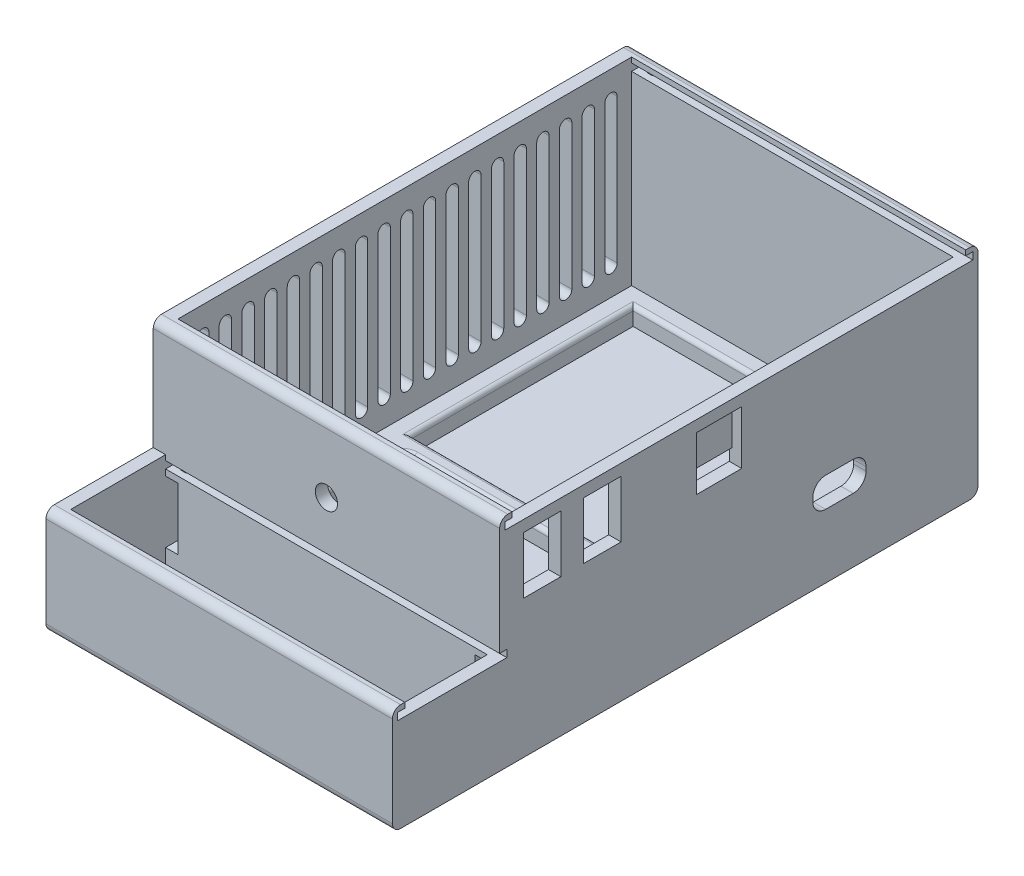
from build123d import *

# Parameters (mm, degrees)
SKETCH1_W            = 100
SKETCH1_H            = 150
BOSS_EXTRUDE1_DEPTH  = 5
SKETCH2_W            = 78
SKETCH2_H            = 23
CUT_EXTRUDE1_DEPTH   = 2.5
SKETCH3_W            = 84
SKETCH3_H            = 29
SKETCH3_W_2          = 78
SKETCH3_H_2          = 23
BOSS_EXTRUDE2_DEPTH  = 18
CUT_EXTRUDE2_DEPTH   = 4.25
CUT_EXTRUDE3_DEPTH   = 0.5
SKETCH8_W            = 3
SKETCH8_H            = 15
CUT_EXTRUDE4_DEPTH   = 3
SKETCH9_W            = 29
SKETCH9_H            = 3
BOSS_EXTRUDE4_DEPTH  = 3
BOSS_EXTRUDE5_DEPTH  = 81
CUT_EXTRUDE5_DEPTH   = 5
BOSS_EXTRUDE6_DEPTH  = 45
SKETCH14_W           = 68.5
SKETCH14_H           = 53.4
CUT_EXTRUDE6_DEPTH   = 4.25
SKETCH46_W           = 69
SKETCH46_H           = 53.9
SKETCH46_W_2         = 68.5
SKETCH46_H_2         = 53.4
CUT_EXTRUDE25_DEPTH  = 4.25
SKETCH15_W           = 84
SKETCH15_H           = 3
BOSS_EXTRUDE7_DEPTH  = 24
BOSS_EXTRUDE8_DEPTH  = 3
SKETCH19_W           = 1.75
SKETCH19_H           = 1.75
CUT_EXTRUDE8_DEPTH   = 81
SKETCH23_W           = 1.75
SKETCH23_H           = 1.25
BOSS_EXTRUDE9_DEPTH  = 0.4
FILLET2_R            = 0.4
SKETCH40_W           = 1.75
SKETCH40_H           = 1.25
BOSS_EXTRUDE14_DEPTH = 0.4
FILLET6_R            = 0.4
SKETCH25_W           = 1.75
SKETCH25_H           = 1.25
BOSS_EXTRUDE11_DEPTH = 0.4
FILLET4_R            = 0.4
SKETCH26_W           = 1.75
SKETCH26_H           = 1.25
BOSS_EXTRUDE12_DEPTH = 0.4
FILLET5_R            = 0.4
SKETCH27_W           = 10.45
SKETCH27_H           = 12.5
CUT_EXTRUDE10_DEPTH  = 3
SKETCH29_W           = 8.6
SKETCH29_H           = 13.3
CUT_EXTRUDE11_DEPTH  = 3
SKETCH30_R           = 2.5
CUT_EXTRUDE12_DEPTH  = 3
CUT_EXTRUDE13_DEPTH  = 3
CUT_EXTRUDE15_DEPTH  = 3
CUT_EXTRUDE16_DEPTH  = 4.25
SKETCH36_W           = 10.95
SKETCH36_H           = 13
SKETCH36_W_2         = 9.1
SKETCH36_H_2         = 13.8
CUT_EXTRUDE18_DEPTH  = 3
SKETCH37_R           = 2.7
CUT_EXTRUDE19_DEPTH  = 3
SKETCH38_W           = 10.95
SKETCH38_H           = 9.86
BOSS_EXTRUDE13_DEPTH = 0.6
CUT_EXTRUDE20_DEPTH  = 3
FILLET18_R           = 2
FILLET19_R           = 1


with BuildPart() as part:
    # Sketch1 → Boss-Extrude1 (new body)
    with BuildSketch(Plane(origin=(0, 0, 0), x_dir=(1, 0, 0), z_dir=(0, 1, 0))):
        with Locations((50, 75)):
            Rectangle(SKETCH1_W, SKETCH1_H)
    extrude(amount=-BOSS_EXTRUDE1_DEPTH)

    # Sketch2 → Cut-Extrude1 (cut)
    with BuildSketch(Plane(origin=(0, 0, 0), x_dir=(1, 0, 0), z_dir=(0, 1, 0))):
        with Locations((50, 22.5)):
            Rectangle(SKETCH2_W, SKETCH2_H)
    extrude(amount=-CUT_EXTRUDE1_DEPTH, mode=Mode.SUBTRACT)

    # Sketch3 → Boss-Extrude2 (add)
    with BuildSketch(Plane(origin=(0, 0, 0), x_dir=(1, 0, 0), z_dir=(0, 1, 0))):
        with Locations((50, 22.5)):
            Rectangle(SKETCH3_W, SKETCH3_H)
        with Locations((50, 22.5)):
            Rectangle(SKETCH3_W_2, SKETCH3_H_2, mode=Mode.SUBTRACT)
    extrude(amount=BOSS_EXTRUDE2_DEPTH)

    # Sketch4 → Cut-Extrude2 (cut)
    with BuildSketch(Plane(origin=(0, 0, 0), x_dir=(1, 0, 0), z_dir=(0, 1, 0))):
        with BuildLine():
            Line((17.27, 44), (79.94, 44))
            ThreePointArc((79.94, 44), (81.91282792, 44.81717208), (82.73, 46.79))
            Line((82.73, 46.79), (82.73, 82.03))
            ThreePointArc((82.73, 82.03), (81.91282792, 84.00282792), (79.94, 84.82))
            Line((79.94, 84.82), (20.06, 84.842465549))
            ThreePointArc((20.06, 84.842465549), (18.08717208, 84.025293468), (17.27, 82.052465549))
            Line((17.27, 82.052465549), (17.27, 44))
        make_face()
    extrude(amount=-CUT_EXTRUDE2_DEPTH, mode=Mode.SUBTRACT)

    # Sketch7 → Cut-Extrude3 (cut)
    with BuildSketch(Plane(origin=(0, -2.5, 0), x_dir=(1, 0, 0), z_dir=(0, 1, 0))):
        Polygon((11, 34), (34, 11), (32.978260085, 11), (11, 32.978260085), align=None)
        Polygon((12, 34), (35, 11), (36, 11), (13, 34), align=None)
        Polygon((11, 11), (11.521721863, 11), (11, 11.521721863), align=None)
        Polygon((89, 34), (89, 33), (88, 34), align=None)
        Polygon((14, 34), (37, 11), (38, 11), (15, 34), align=None)
        Polygon((16, 34), (39, 11), (40, 11), (17, 34), align=None)
        Polygon((18, 34), (41, 11), (42, 11), (19, 34), align=None)
        Polygon((20, 34), (43, 11), (44, 11), (21, 34), align=None)
        Polygon((22, 34), (45, 11), (46, 11), (23, 34), align=None)
        Polygon((24, 34), (47, 11), (48, 11), (25, 34), align=None)
        Polygon((26, 34), (49, 11), (50, 11), (27, 34), align=None)
        Polygon((28, 34), (51, 11), (52, 11), (29, 34), align=None)
        Polygon((30, 34), (53, 11), (54, 11), (31, 34), align=None)
        Polygon((32, 34), (55, 11), (56, 11), (33, 34), align=None)
        Polygon((34, 34), (57, 11), (58, 11), (35, 34), align=None)
        Polygon((36, 34), (59, 11), (60, 11), (37, 34), align=None)
        Polygon((38, 34), (61, 11), (62, 11), (39, 34), align=None)
        Polygon((40, 34), (63, 11), (64, 11), (41, 34), align=None)
        Polygon((42, 34), (65, 11), (66, 11), (43, 34), align=None)
        Polygon((44, 34), (67, 11), (68, 11), (45, 34), align=None)
        Polygon((46, 34), (69, 11), (70, 11), (47, 34), align=None)
        Polygon((48, 34), (71, 11), (72, 11), (49, 34), align=None)
        Polygon((50, 34), (73, 11), (74, 11), (51, 34), align=None)
        Polygon((52, 34), (75, 11), (76, 11), (53, 34), align=None)
        Polygon((54, 34), (77, 11), (78, 11), (55, 34), align=None)
        Polygon((56, 34), (79, 11), (80, 11), (57, 34), align=None)
        Polygon((58, 34), (81, 11), (82, 11), (59, 34), align=None)
        Polygon((60, 34), (83, 11), (84, 11), (61, 34), align=None)
        Polygon((62, 34), (85, 11), (86, 11), (63, 34), align=None)
        Polygon((64, 34), (87, 11), (88, 11), (65, 34), align=None)
        Polygon((66, 34), (89, 11), (89, 12), (67, 34), align=None)
        Polygon((68, 34), (89, 13), (89, 14), (69, 34), align=None)
        Polygon((70, 34), (89, 15), (89, 16), (71, 34), align=None)
        Polygon((72, 34), (89, 17), (89, 18), (73, 34), align=None)
        Polygon((74, 34), (89, 19), (89, 20), (75, 34), align=None)
        Polygon((76, 34), (89, 21), (89, 22), (77, 34), align=None)
        Polygon((78, 34), (89, 23), (89, 24), (79, 34), align=None)
        Polygon((80, 34), (89, 25), (89, 26), (81, 34), align=None)
        Polygon((82, 34), (89, 27), (89, 28), (83, 34), align=None)
        Polygon((84, 34), (89, 29), (89, 30), (85, 34), align=None)
        Polygon((86, 34), (89, 31), (89, 32), (87, 34), align=None)
        Polygon((11, 31.956520169), (31.956520169, 11), (30.934780254, 11), (11, 30.934780254), align=None)
        Polygon((11, 29.913040339), (29.913040339, 11), (28.891300423, 11), (11, 28.891300423), align=None)
        Polygon((11, 27.869560508), (27.869560508, 11), (26.847820593, 11), (11, 26.847820593), align=None)
        Polygon((11, 25.826080677), (25.826080677, 11), (24.804340762, 11), (11, 24.804340762), align=None)
        Polygon((11, 23.782600847), (23.782600847, 11), (22.760860931, 11), (11, 22.760860931), align=None)
        Polygon((11, 21.739121016), (21.739121016, 11), (20.717381101, 11), (11, 20.717381101), align=None)
        Polygon((11, 19.695641185), (19.695641185, 11), (18.67390127, 11), (11, 18.67390127), align=None)
        Polygon((11, 17.652161355), (17.652161355, 11), (16.630421439, 11), (11, 16.630421439), align=None)
        Polygon((11, 15.608681524), (15.608681524, 11), (14.586941609, 11), (11, 14.586941609), align=None)
        Polygon((11, 13.565201693), (13.565201693, 11), (12.543461778, 11), (11, 12.543461778), align=None)
    extrude(amount=-CUT_EXTRUDE3_DEPTH, mode=Mode.SUBTRACT)

    # Sketch8 → Cut-Extrude4 (cut)
    with BuildSketch(Plane(origin=(0, 0, -37), x_dir=(-1, 0, 0), z_dir=(0, 0, -1))):
        with Locations((-87.5, 9)):
            Rectangle(SKETCH8_W, SKETCH8_H)
        with Locations((-12.5, 9)):
            Rectangle(SKETCH8_W, SKETCH8_H)
    extrude(amount=-CUT_EXTRUDE4_DEPTH, mode=Mode.SUBTRACT)

    # Sketch9 → Boss-Extrude4 (add)
    with BuildSketch(Plane.ZY.offset(-8)):
        with Locations((-22.5, 19.5)):
            Rectangle(SKETCH9_W, SKETCH9_H)
    extrude(amount=-BOSS_EXTRUDE4_DEPTH)

    # Sketch10 → Boss-Extrude5 (add)
    with BuildSketch(Plane(origin=(11, 0, 0), x_dir=(0, 0, -1), z_dir=(1, 0, 0))):
        Polygon((9.25, 18), (8, 18), (8, 21), (11, 21), (11, 19.75), (9.25, 19.75), align=None)
        Polygon((35.75, 19.75), (35.75, 18), (37, 18), (37, 21), (34, 21), (34, 19.75), align=None)
    extrude(amount=BOSS_EXTRUDE5_DEPTH)

    # Sketch12 → Cut-Extrude5 (cut)
    with BuildSketch(Plane(origin=(0, 0, 0), x_dir=(1, 0, 0), z_dir=(0, 1, 0))):
        Polygon((0, 0), (100, 0), (100, 150), (92, 150), (92, 8), (8, 8), (8, 150), (0, 150), align=None)
    extrude(amount=-CUT_EXTRUDE5_DEPTH, mode=Mode.SUBTRACT)

    # Sketch13 → Boss-Extrude6 (add)
    with BuildSketch(Plane(origin=(0, 0, 0), x_dir=(1, 0, 0), z_dir=(0, 1, 0))):
        Polygon((8, 37), (8, 150), (92, 150), (92, 37), (89, 37), (89, 40), (89, 147), (11, 147), (11, 40), (11, 37), align=None)
    extrude(amount=BOSS_EXTRUDE6_DEPTH)

    # Sketch14 → Cut-Extrude6 (cut)
    with BuildSketch(Plane(origin=(0, 0, 0), x_dir=(1, 0, 0), z_dir=(0, 1, 0))):
        with Locations((50, 115.915616387)):
            Rectangle(SKETCH14_W, SKETCH14_H)
    extrude(amount=-CUT_EXTRUDE6_DEPTH, mode=Mode.SUBTRACT)

    # Sketch46 → Cut-Extrude25 (cut)
    with BuildSketch(Plane(origin=(0, 0, 0), x_dir=(1, 0, 0), z_dir=(0, 1, 0))):
        with Locations((50, 115.915616387)):
            Rectangle(SKETCH46_W, SKETCH46_H)
        with Locations((50, 115.915616387)):
            Rectangle(SKETCH46_W_2, SKETCH46_H_2, mode=Mode.SUBTRACT)
    extrude(amount=-CUT_EXTRUDE25_DEPTH, mode=Mode.SUBTRACT)

    # Sketch15 → Boss-Extrude7 (add)
    with BuildSketch(Plane(origin=(0, 21, 0), x_dir=(1, 0, 0), z_dir=(0, 1, 0))):
        with Locations((50, 35.5)):
            Rectangle(SKETCH15_W, SKETCH15_H)
    extrude(amount=BOSS_EXTRUDE7_DEPTH)

    # Sketch16 → Boss-Extrude8 (add)
    with BuildSketch(Plane(origin=(0, 45, 0), x_dir=(1, 0, 0), z_dir=(0, 1, 0))):
        Polygon((92, 34), (8, 34), (8, 150), (92, 150), (92, 147), (11, 147), (11, 37), (92, 37), align=None)
    extrude(amount=BOSS_EXTRUDE8_DEPTH)

    # Sketch19 → Cut-Extrude8 (cut)
    with BuildSketch(Plane(origin=(92, 0, 0), x_dir=(0, 0, -1), z_dir=(1, 0, 0))):
        with Locations((36.125, 45.875)):
            Rectangle(SKETCH19_W, SKETCH19_H)
        with Locations((147.875, 45.875)):
            Rectangle(SKETCH19_W, SKETCH19_H)
    extrude(amount=-CUT_EXTRUDE8_DEPTH, mode=Mode.SUBTRACT)

    # Sketch23 → Boss-Extrude9 (add)
    with BuildSketch(Plane(origin=(0, 0, -9.25), x_dir=(-1, 0, 0), z_dir=(0, 0, -1))):
        with Locations((-14, 18.875)):
            Rectangle(SKETCH23_W, SKETCH23_H)
    extrude(amount=BOSS_EXTRUDE9_DEPTH)

    # Fillet2
    fillet2_edges = [part.edges().sort_by_distance(p)[0] for p in [
        (13.125, 18.875, -9.65),
        (14.875, 18.875, -9.65),
    ]]
    fillet(fillet2_edges, radius=FILLET2_R - 0.0001)  # a hair under: the kernel refuses the full size

    # Sketch40 → Boss-Extrude14 (add)
    with BuildSketch(Plane.XY.offset(-35.75)):
        with Locations((14, 18.875)):
            Rectangle(SKETCH40_W, SKETCH40_H)
    extrude(amount=BOSS_EXTRUDE14_DEPTH)

    # Fillet6
    fillet6_edges = [part.edges().sort_by_distance(p)[0] for p in [
        (14.875, 18.875, -35.35),
        (13.125, 18.875, -35.35),
    ]]
    fillet(fillet6_edges, radius=FILLET6_R - 0.0001)  # a hair under: the kernel refuses the full size

    # Sketch25 → Boss-Extrude11 (add)
    with BuildSketch(Plane(origin=(0, 0, -35.25), x_dir=(-1, 0, 0), z_dir=(0, 0, -1))):
        with Locations((-14, 45.875)):
            Rectangle(SKETCH25_W, SKETCH25_H)
    extrude(amount=BOSS_EXTRUDE11_DEPTH)

    # Fillet4
    fillet4_edges = [part.edges().sort_by_distance(p)[0] for p in [
        (13.125, 45.875, -35.65),
        (14.875, 45.875, -35.65),
    ]]
    fillet(fillet4_edges, radius=FILLET4_R - 0.0001)  # a hair under: the kernel refuses the full size

    # Sketch26 → Boss-Extrude12 (add)
    with BuildSketch(Plane.XY.offset(-148.75)):
        with Locations((14, 45.875)):
            Rectangle(SKETCH26_W, SKETCH26_H)
    extrude(amount=BOSS_EXTRUDE12_DEPTH)

    # Fillet5
    fillet5_edges = [part.edges().sort_by_distance(p)[0] for p in [
        (13.125, 45.875, -148.35),
        (14.875, 45.875, -148.35),
    ]]
    fillet(fillet5_edges, radius=FILLET5_R - 0.0001)  # a hair under: the kernel refuses the full size

    # Sketch27 → Cut-Extrude10 (cut)
    with BuildSketch(Plane(origin=(92, 0, 0), x_dir=(0, 0, -1), z_dir=(1, 0, 0))):
        with Locations((87.225, 35.75)):
            Rectangle(SKETCH27_W, SKETCH27_H)
    extrude(amount=-CUT_EXTRUDE10_DEPTH, mode=Mode.SUBTRACT)

    # Sketch29 → Cut-Extrude11 (cut)
    with BuildSketch(Plane(origin=(92, 0, 0), x_dir=(0, 0, -1), z_dir=(1, 0, 0))):
        with Locations((44.3, 35.35)):
            Rectangle(SKETCH29_W, SKETCH29_H)
        with Locations((58.9, 35.35)):
            Rectangle(SKETCH29_W, SKETCH29_H)
    extrude(amount=-CUT_EXTRUDE11_DEPTH, mode=Mode.SUBTRACT)

    # Sketch30 → Cut-Extrude12 (cut)
    with BuildSketch(Plane.XY.offset(-34)):
        with Locations((50, 31.5)):
            Circle(SKETCH30_R)
    extrude(amount=-CUT_EXTRUDE12_DEPTH, mode=Mode.SUBTRACT)

    # Sketch31 → Cut-Extrude13 (cut)
    with BuildSketch(Plane(origin=(92, 0, 0), x_dir=(0, 0, -1), z_dir=(1, 0, 0))):
        with BuildLine():
            Line((113.05, 12.5), (119.75, 12.5))
            ThreePointArc((119.75, 12.5), (120.527817459, 12.822182541), (120.85, 13.6))
            Line((120.85, 13.6), (120.85, 14.55))
            ThreePointArc((120.85, 14.55), (120.527817459, 15.327817459), (119.75, 15.65))
            Line((119.75, 15.65), (113.05, 15.65))
            ThreePointArc((113.05, 15.65), (112.272182541, 15.327817459), (111.95, 14.55))
            Line((111.95, 14.55), (111.95, 13.6))
            ThreePointArc((111.95, 13.6), (112.272182541, 12.822182541), (113.05, 12.5))
        make_face()
    extrude(amount=-CUT_EXTRUDE13_DEPTH, mode=Mode.SUBTRACT)

    # Sketch33 → Cut-Extrude15 (cut)
    with BuildSketch(Plane(origin=(11, 0, 0), x_dir=(0, 0, -1), z_dir=(1, 0, 0))):
        with BuildLine():
            Line((140.5, 6.5), (140.5, 41.5))
            ThreePointArc((140.5, 41.5), (142, 43), (143.5, 41.5))
            Line((143.5, 41.5), (143.5, 6.5))
            ThreePointArc((143.5, 6.5), (142, 5), (140.5, 6.5))
        make_face()
        with BuildLine():
            Line((135, 6.5), (135, 41.5))
            ThreePointArc((135, 41.5), (136.5, 43), (138, 41.5))
            Line((138, 41.5), (138, 6.5))
            ThreePointArc((138, 6.5), (136.5, 5), (135, 6.5))
        make_face()
        with BuildLine():
            Line((129.5, 6.5), (129.5, 41.5))
            ThreePointArc((129.5, 41.5), (131, 43), (132.5, 41.5))
            Line((132.5, 41.5), (132.5, 6.5))
            ThreePointArc((132.5, 6.5), (131, 5), (129.5, 6.5))
        make_face()
        with BuildLine():
            Line((124, 6.5), (124, 41.5))
            ThreePointArc((124, 41.5), (125.5, 43), (127, 41.5))
            Line((127, 41.5), (127, 6.5))
            ThreePointArc((127, 6.5), (125.5, 5), (124, 6.5))
        make_face()
        with BuildLine():
            Line((118.5, 6.5), (118.5, 41.5))
            ThreePointArc((118.5, 41.5), (120, 43), (121.5, 41.5))
            Line((121.5, 41.5), (121.5, 6.5))
            ThreePointArc((121.5, 6.5), (120, 5), (118.5, 6.5))
        make_face()
        with BuildLine():
            Line((113, 6.5), (113, 41.5))
            ThreePointArc((113, 41.5), (114.5, 43), (116, 41.5))
            Line((116, 41.5), (116, 6.5))
            ThreePointArc((116, 6.5), (114.5, 5), (113, 6.5))
        make_face()
        with BuildLine():
            Line((107.5, 6.5), (107.5, 41.5))
            ThreePointArc((107.5, 41.5), (109, 43), (110.5, 41.5))
            Line((110.5, 41.5), (110.5, 6.5))
            ThreePointArc((110.5, 6.5), (109, 5), (107.5, 6.5))
        make_face()
        with BuildLine():
            Line((102, 6.5), (102, 41.5))
            ThreePointArc((102, 41.5), (103.5, 43), (105, 41.5))
            Line((105, 41.5), (105, 6.5))
            ThreePointArc((105, 6.5), (103.5, 5), (102, 6.5))
        make_face()
        with BuildLine():
            Line((96.5, 6.5), (96.5, 41.5))
            ThreePointArc((96.5, 41.5), (98, 43), (99.5, 41.5))
            Line((99.5, 41.5), (99.5, 6.5))
            ThreePointArc((99.5, 6.5), (98, 5), (96.5, 6.5))
        make_face()
        with BuildLine():
            Line((91, 6.5), (91, 41.5))
            ThreePointArc((91, 41.5), (92.5, 43), (94, 41.5))
            Line((94, 41.5), (94, 6.5))
            ThreePointArc((94, 6.5), (92.5, 5), (91, 6.5))
        make_face()
        with BuildLine():
            Line((85.5, 6.5), (85.5, 41.5))
            ThreePointArc((85.5, 41.5), (87, 43), (88.5, 41.5))
            Line((88.5, 41.5), (88.5, 6.5))
            ThreePointArc((88.5, 6.5), (87, 5), (85.5, 6.5))
        make_face()
        with BuildLine():
            Line((80, 6.5), (80, 41.5))
            ThreePointArc((80, 41.5), (81.5, 43), (83, 41.5))
            Line((83, 41.5), (83, 6.5))
            ThreePointArc((83, 6.5), (81.5, 5), (80, 6.5))
        make_face()
        with BuildLine():
            Line((74.5, 6.5), (74.5, 41.5))
            ThreePointArc((74.5, 41.5), (76, 43), (77.5, 41.5))
            Line((77.5, 41.5), (77.5, 6.5))
            ThreePointArc((77.5, 6.5), (76, 5), (74.5, 6.5))
        make_face()
        with BuildLine():
            Line((69, 6.5), (69, 41.5))
            ThreePointArc((69, 41.5), (70.5, 43), (72, 41.5))
            Line((72, 41.5), (72, 6.5))
            ThreePointArc((72, 6.5), (70.5, 5), (69, 6.5))
        make_face()
        with BuildLine():
            Line((63.5, 6.5), (63.5, 41.5))
            ThreePointArc((63.5, 41.5), (65, 43), (66.5, 41.5))
            Line((66.5, 41.5), (66.5, 6.5))
            ThreePointArc((66.5, 6.5), (65, 5), (63.5, 6.5))
        make_face()
        with BuildLine():
            Line((58, 6.5), (58, 41.5))
            ThreePointArc((58, 41.5), (59.5, 43), (61, 41.5))
            Line((61, 41.5), (61, 6.5))
            ThreePointArc((61, 6.5), (59.5, 5), (58, 6.5))
        make_face()
        with BuildLine():
            Line((52.5, 6.5), (52.5, 41.5))
            ThreePointArc((52.5, 41.5), (54, 43), (55.5, 41.5))
            Line((55.5, 41.5), (55.5, 6.5))
            ThreePointArc((55.5, 6.5), (54, 5), (52.5, 6.5))
        make_face()
        with BuildLine():
            Line((47, 6.5), (47, 41.5))
            ThreePointArc((47, 41.5), (48.5, 43), (50, 41.5))
            Line((50, 41.5), (50, 6.5))
            ThreePointArc((50, 6.5), (48.5, 5), (47, 6.5))
        make_face()
        with BuildLine():
            Line((41.5, 6.5), (41.5, 41.5))
            ThreePointArc((41.5, 41.5), (43, 43), (44.5, 41.5))
            Line((44.5, 41.5), (44.5, 6.5))
            ThreePointArc((44.5, 6.5), (43, 5), (41.5, 6.5))
        make_face()
    extrude(amount=-CUT_EXTRUDE15_DEPTH, mode=Mode.SUBTRACT)

    # Sketch34 → Cut-Extrude16 (cut)
    with BuildSketch(Plane(origin=(0, 0, 0), x_dir=(1, 0, 0), z_dir=(0, 1, 0))):
        with BuildLine():
            Line((17.02, 82.052465549), (17.02, 43.75))
            Line((17.02, 43.75), (79.94, 43.75))
            ThreePointArc((79.94, 43.75), (82.089604615, 44.640395385), (82.98, 46.79))
            Line((82.98, 46.79), (82.98, 82.03))
            ThreePointArc((82.98, 82.03), (82.089637776, 84.179571453), (79.940093794, 85.069999982))
            Line((79.940093794, 85.069999982), (20.06, 85.092465549))
            ThreePointArc((20.06, 85.092465549), (17.910395385, 84.202070164), (17.02, 82.052465549))
        make_face()
    extrude(amount=-CUT_EXTRUDE16_DEPTH, mode=Mode.SUBTRACT)

    # Sketch36 → Cut-Extrude18 (cut)
    with BuildSketch(Plane(origin=(92, 0, 0), x_dir=(0, 0, -1), z_dir=(1, 0, 0))):
        with Locations((87.225, 35.75)):
            Rectangle(SKETCH36_W, SKETCH36_H)
        with Locations((44.3, 35.35)):
            Rectangle(SKETCH36_W_2, SKETCH36_H_2)
        with Locations((58.9, 35.35)):
            Rectangle(SKETCH36_W_2, SKETCH36_H_2)
    extrude(amount=-CUT_EXTRUDE18_DEPTH, mode=Mode.SUBTRACT)

    # Sketch37 → Cut-Extrude19 (cut)
    with BuildSketch(Plane.XY.offset(-34)):
        with Locations((50, 31.5)):
            Circle(SKETCH37_R)
    extrude(amount=-CUT_EXTRUDE19_DEPTH, mode=Mode.SUBTRACT)

    # Sketch38 → Boss-Extrude13 (add)
    with BuildSketch(Plane.ZY.offset(-89)):
        with Locations((-87.225, 37.32)):
            Rectangle(SKETCH38_W, SKETCH38_H)
    extrude(amount=-BOSS_EXTRUDE13_DEPTH)

    # Sketch39 → Cut-Extrude20 (cut)
    with BuildSketch(Plane(origin=(92, 0, 0), x_dir=(0, 0, -1), z_dir=(1, 0, 0))):
        with BuildLine():
            Line((122.85, 13.6), (122.85, 14.55))
            ThreePointArc((122.85, 14.55), (121.942031022, 16.742031022), (119.75, 17.65))
            Line((119.75, 17.65), (113.05, 17.65))
            ThreePointArc((113.05, 17.65), (110.857968978, 16.742031022), (109.95, 14.55))
            Line((109.95, 14.55), (109.95, 13.6))
            ThreePointArc((109.95, 13.6), (110.857968978, 11.407968978), (113.05, 10.5))
            Line((113.05, 10.5), (119.75, 10.5))
            ThreePointArc((119.75, 10.5), (121.942031022, 11.407968978), (122.85, 13.6))
        make_face()
    extrude(amount=-CUT_EXTRUDE20_DEPTH, mode=Mode.SUBTRACT)

    # Fillet18
    fillet18_edges = [part.edges().sort_by_distance(p)[0] for p in [
        (50, 21, -8),
        (50, -5, -150),
        (50, -5, -8),
        (50, 48, -150),
        (50, 48, -34),
    ]]
    fillet(fillet18_edges, radius=FILLET18_R)

    # Fillet19
    fillet19_edges = [part.edges().sort_by_distance(p)[0] for p in [
        (17.910395385, 0, -84.202070164),
        (17.02, 0, -62.901232774),
        (48.48, 0, -43.75),
        (82.089604615, 0, -44.640395385),
        (82.98, 0, -64.41),
        (82.089637778, 0, -84.179571451),
        (50.000046897, 0, -85.081232766),
        (50, 0, -142.865616387),
        (15.5, 0, -115.915616387),
        (50, 0, -88.965616387),
        (84.5, 0, -115.915616387),
    ]]
    fillet(fillet19_edges, radius=FILLET19_R)


solid = part.part
